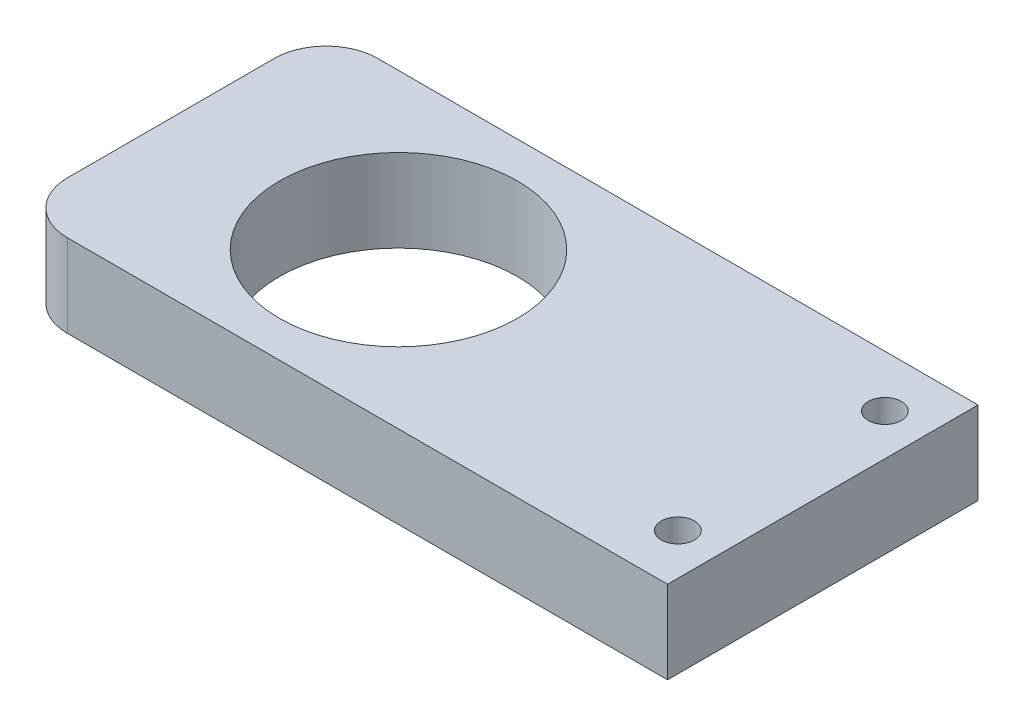
from build123d import *

# Parameters (mm, degrees)
SKETCH1_W           = 63
SKETCH1_H           = 30
SKETCH1_R           = 11.5
BOSS_EXTRUDE1_DEPTH = 8
SKETCH2_R           = 1.6
CUT_EXTRUDE1_DEPTH  = 71.235318751
FILLET1_R           = 5


with BuildPart() as part:
    # Sketch1 → Boss-Extrude1 (new body)
    with BuildSketch(Plane(origin=(0, 0, 0), x_dir=(1, 0, 0), z_dir=(0, 1, 0))):
        with Locations((31.5, 15)):
            Rectangle(SKETCH1_W, SKETCH1_H)
        with Locations((22, 15)):
            Circle(SKETCH1_R, mode=Mode.SUBTRACT)
    extrude(amount=BOSS_EXTRUDE1_DEPTH)

    # Sketch2 → Cut-Extrude1 (cut, through all)
    with BuildSketch(Plane(origin=(0, 8, 0), x_dir=(1, 0, 0), z_dir=(0, 1, 0))):
        with Locations((59, 25)):
            Circle(SKETCH2_R)
        with Locations((59, 5)):
            Circle(SKETCH2_R)
    extrude(amount=-CUT_EXTRUDE1_DEPTH, mode=Mode.SUBTRACT)

    # Fillet1
    fillet1_edges = [part.edges().sort_by_distance(p)[0] for p in [
        (0, 4, 0),
        (0, 4, -30),
    ]]
    fillet(fillet1_edges, radius=FILLET1_R)


solid = part.part
